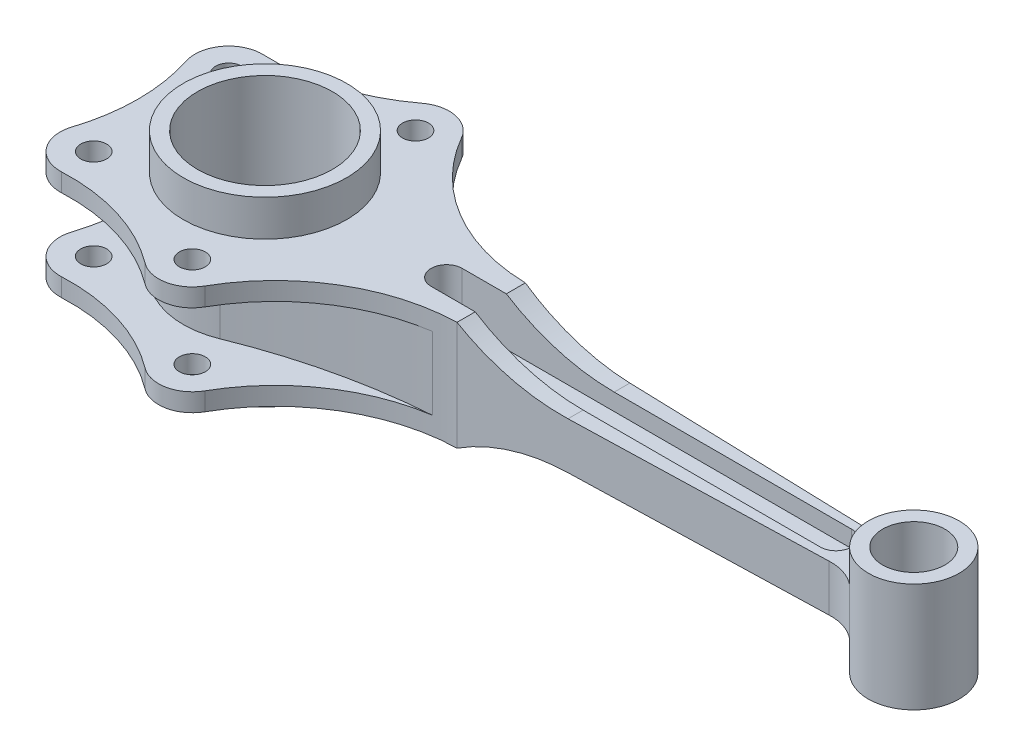
from build123d import *

# Parameters (mm, degrees)
SKETCH1_R               = 17.5
SKETCH1_R_2             = 12
BOSS_EXTRUDE1_DEPTH     = 21
BOSS_EXTRUDE2_DEPTH     = 2.5
BOSS_EXTRUDE3_DEPTH     = 21
SKETCH1_6_R             = 31.5
SKETCH1_6_R_2           = 26
BOSS_EXTRUDE4_DEPTH     = 35
BOSS_EXTRUDE5_START     = 14
SKETCH1_8_R             = 5
BOSS_EXTRUDE5_DEPTH     = 7
BOSS_EXTRUDE6_START     = -14
SKETCH1_9_R             = 5
BOSS_EXTRUDE6_DEPTH     = 7
BOSS_EXTRUDE7_DEPTH     = 21
CUT_EXTRUDE1_DEPTH      = 209.248049211
CUT_EXTRUDE1_DEPTH_BACK = 209.248049211
CUT_EXTRUDE2_START      = -56
CUT_EXTRUDE2_DEPTH      = 56
CUT_EXTRUDE3_DEPTH      = 209.248049211
CUT_EXTRUDE3_DEPTH_BACK = 209.248049211
CUT_EXTRUDE4_DEPTH      = 212.910476009
CUT_EXTRUDE4_DEPTH_BACK = 212.910476009
SKETCH4_W               = 12.113399832
SKETCH4_H               = 12
CUT_EXTRUDE5_DEPTH      = 212.910476009
CUT_EXTRUDE5_DEPTH_BACK = 212.910476009
SKETCH4_3_W             = 12.113399832
SKETCH4_3_H             = 12
SKETCH5_R               = 17.5
SKETCH5_R_2             = 12
BOSS_EXTRUDE8_DEPTH     = 42


with BuildPart() as part:
    # Sketch1 → Boss-Extrude1 (new, symmetric)
    with BuildSketch(Plane(origin=(0, 0, 0), x_dir=(1, 0, 0), z_dir=(0, 1, 0))):
        with Locations(Location((180, 0, 0), (0, 0, 90))):
            Circle(SKETCH1_R)
        with Locations(Location((180, 0, 0), (0, 0, 90))):
            Circle(SKETCH1_R_2, mode=Mode.SUBTRACT)
    extrude(amount=BOSS_EXTRUDE1_DEPTH, both=True)


with BuildPart() as body_2:
    # Sketch1<4> → Boss-Extrude2 (new, symmetric)
    with BuildSketch(Plane(origin=(0, 0, 0), x_dir=(1, 0, 0), z_dir=(0, 1, 0))):
        with BuildLine():
            Line((0, -6), (150, -6))
            ThreePointArc((150, -6), (156, 0), (150, 6))
            Line((150, 6), (0, 6))
            ThreePointArc((0, 6), (-6, 0), (0, -6))
        make_face()
    extrude(amount=BOSS_EXTRUDE2_DEPTH, both=True)


with BuildPart() as body_3:
    # Sketch1<5> → Boss-Extrude3 (new, symmetric)
    with BuildSketch(Plane(origin=(0, 0, 0), x_dir=(1, 0, 0), z_dir=(0, 1, 0))):
        with BuildLine():
            Line((156.058996925, 9.03318931), (17, 13.317393816))
            Line((17, 13.317393816), (17, 6))
            Line((17, 6), (150, 6))
            ThreePointArc((150, 6), (156, 0), (150, -6))
            Line((150, -6), (17, -6))
            Line((17, -6), (17, -13))
            Line((17, -13), (156.328879699, -9.01863519))
            ThreePointArc((156.328879699, -9.01863519), (156.636409525, -9.007140421), (156.944093932, -9.001055257))
            ThreePointArc((156.944093932, -9.001055257), (163.144268536, -10.063638089), (168.568136635, -13.25))
            ThreePointArc((168.568136635, -13.25), (162.5, 0), (168.568136635, 13.25))
            ThreePointArc((168.568136635, 13.25), (163.234428728, 10.096875298), (157.13627327, 9))
            ThreePointArc((157.13627327, 9), (156.597379529, 9.008299295), (156.058996925, 9.03318931))
        make_face()
    extrude(amount=BOSS_EXTRUDE3_DEPTH, both=True)


with BuildPart() as body_4:
    # Sketch1<6> → Boss-Extrude4 (new, symmetric)
    with BuildSketch(Plane(origin=(0, 0, 0), x_dir=(1, 0, 0), z_dir=(0, 1, 0))):
        with Locations(Location((-70, 0, 0), (0, 0, 270))):
            Circle(SKETCH1_6_R)
        with Locations(Location((-70, 0, 0), (0, 0, 270))):
            Circle(SKETCH1_6_R_2, mode=Mode.SUBTRACT)
    extrude(amount=BOSS_EXTRUDE4_DEPTH, both=True)

    # Sketch1<8> → Boss-Extrude5 (add)
    with BuildSketch(Plane(origin=(0, 0, 0), x_dir=(1, 0, 0), z_dir=(0, 1, 0)).offset(BOSS_EXTRUDE5_START)):
        with BuildLine():
            ThreePointArc((-58.156980956, 29.188917416), (-21.997231739, 18.064539792), (15.542269663, 13.367192084))
            ThreePointArc((15.542269663, 13.367192084), (-18.727205495, 23.806647622), (-43.723768891, 49.46889573))
            ThreePointArc((-43.723768891, 49.46889573), (-52.387237507, 55.734734868), (-62.818053323, 53.386435492))
            ThreePointArc((-62.818053323, 53.386435492), (-84.855989459, 42.122318837), (-109.406288617, 38.986435492))
            ThreePointArc((-109.406288617, 38.986435492), (-120.326951915, 33.896458963), (-122.376901133, 22.023529412))
            ThreePointArc((-122.376901133, 22.023529412), (-118.925892025, 0), (-122.376901133, -22.023529412))
            ThreePointArc((-122.376901133, -22.023529412), (-120.326951915, -33.896458963), (-109.406288617, -38.986435492))
            ThreePointArc((-109.406288617, -38.986435492), (-84.855989459, -42.122318837), (-62.818053323, -53.386435492))
            ThreePointArc((-62.818053323, -53.386435492), (-52.359466146, -55.729005498), (-43.695655766, -49.419641847))
            ThreePointArc((-43.695655766, -49.419641847), (-21.801490982, -25.591683128), (8.316675692, -13.758589512))
            ThreePointArc((8.316675692, -13.758589512), (-25.528416407, -18.853360845), (-58.156980956, -29.188917416))
            ThreePointArc((-58.156980956, -29.188917416), (-101.5, 0), (-58.156980956, 29.188917416))
        make_face()
        with Locations(Location((-55, -43, 0), (0, 0, 270))):
            Circle(SKETCH1_8_R, mode=Mode.SUBTRACT)
        with Locations(Location((-110, -26, 0), (0, 0, 270))):
            Circle(SKETCH1_8_R, mode=Mode.SUBTRACT)
        with Locations(Location((-110, 26, 0), (0, 0, 270))):
            Circle(SKETCH1_8_R, mode=Mode.SUBTRACT)
        with Locations(Location((-55, 43, 0), (0, 0, 270))):
            Circle(SKETCH1_8_R, mode=Mode.SUBTRACT)
    extrude(amount=BOSS_EXTRUDE5_DEPTH)

    # Sketch1<9> → Boss-Extrude6 (add)
    with BuildSketch(Plane(origin=(0, 0, 0), x_dir=(1, 0, 0), z_dir=(0, 1, 0)).offset(BOSS_EXTRUDE6_START)):
        with BuildLine():
            ThreePointArc((-58.156980956, 29.188917416), (-21.997231739, 18.064539792), (15.542269663, 13.367192084))
            ThreePointArc((15.542269663, 13.367192084), (-18.727205495, 23.806647622), (-43.723768891, 49.46889573))
            ThreePointArc((-43.723768891, 49.46889573), (-52.387237507, 55.734734868), (-62.818053323, 53.386435492))
            ThreePointArc((-62.818053323, 53.386435492), (-84.855989459, 42.122318837), (-109.406288617, 38.986435492))
            ThreePointArc((-109.406288617, 38.986435492), (-120.326951915, 33.896458963), (-122.376901133, 22.023529412))
            ThreePointArc((-122.376901133, 22.023529412), (-118.925892025, 0), (-122.376901133, -22.023529412))
            ThreePointArc((-122.376901133, -22.023529412), (-120.326951915, -33.896458963), (-109.406288617, -38.986435492))
            ThreePointArc((-109.406288617, -38.986435492), (-84.855989459, -42.122318837), (-62.818053323, -53.386435492))
            ThreePointArc((-62.818053323, -53.386435492), (-52.359466146, -55.729005498), (-43.695655766, -49.419641847))
            ThreePointArc((-43.695655766, -49.419641847), (-21.801490982, -25.591683128), (8.316675692, -13.758589512))
            ThreePointArc((8.316675692, -13.758589512), (-25.528416407, -18.853360845), (-58.156980956, -29.188917416))
            ThreePointArc((-58.156980956, -29.188917416), (-101.5, 0), (-58.156980956, 29.188917416))
        make_face()
        with Locations(Location((-55, -43, 0), (0, 0, 270))):
            Circle(SKETCH1_9_R, mode=Mode.SUBTRACT)
        with Locations(Location((-110, -26, 0), (0, 0, 270))):
            Circle(SKETCH1_9_R, mode=Mode.SUBTRACT)
        with Locations(Location((-110, 26, 0), (0, 0, 270))):
            Circle(SKETCH1_9_R, mode=Mode.SUBTRACT)
        with Locations(Location((-55, 43, 0), (0, 0, 270))):
            Circle(SKETCH1_9_R, mode=Mode.SUBTRACT)
    extrude(amount=-BOSS_EXTRUDE6_DEPTH)


with BuildPart() as boss_extrude7_tool:
    # Sketch1<10> → Boss-Extrude7 (new, symmetric)
    with BuildSketch(Plane(origin=(0, 0, 0), x_dir=(1, 0, 0), z_dir=(0, 1, 0))):
        with BuildLine():
            Line((17, 6), (17, 13.317393816))
            ThreePointArc((17, 13.317393816), (16.271008726, 13.338601506), (15.542269663, 13.367192084))
            ThreePointArc((15.542269663, 13.367192084), (-21.997231739, 18.064539792), (-58.156980956, 29.188917416))
            ThreePointArc((-58.156980956, 29.188917416), (-43.872379558, 17.595381498), (-38.5, 0))
            Line((-38.5, 0), (-6, 0))
            ThreePointArc((-6, 0), (-4.242640687, 4.242640687), (0, 6))
            Line((0, 6), (17, 6))
        make_face()
        with BuildLine():
            ThreePointArc((0, -6), (-4.242640687, -4.242640687), (-6, 0))
            Line((-6, 0), (-38.5, 0))
            ThreePointArc((-38.5, 0), (-43.872379558, -17.595381498), (-58.156980956, -29.188917416))
            ThreePointArc((-58.156980956, -29.188917416), (-25.528416407, -18.853360845), (8.316675692, -13.758589512))
            ThreePointArc((8.316675692, -13.758589512), (12.646847854, -13.247772605), (17, -13))
            Line((17, -13), (17, -6))
            Line((17, -6), (0, -6))
        make_face()
    extrude(amount=BOSS_EXTRUDE7_DEPTH, both=True)


with BuildPart() as body_3_1:
    add(body_3.part)


with BuildPart() as body_3_2:
    # Boss-Extrude7: joined with boss_extrude7_tool
    add(body_3_1.part.fuse(boss_extrude7_tool.part, body_4.part, tol=0.00001))

    # Sketch3 → Cut-Extrude1 (cut, two sides: drawn at the far end of the back side and taken through both)
    with BuildSketch(Plane.XY.offset(-CUT_EXTRUDE1_DEPTH_BACK)):
        with BuildLine():
            Line((156.328879699, 9), (58.569219382, 9))
            ThreePointArc((58.569219382, 9), (36.935911729, 12.060024019), (17, 21))
            Line((17, 21), (156.328879699, 21))
            Line((156.328879699, 21), (156.328879699, 9))
        make_face()
    extrude(amount=CUT_EXTRUDE1_DEPTH + CUT_EXTRUDE1_DEPTH_BACK, mode=Mode.SUBTRACT)

    # Cut-Extrude2: read off the stored shape, not the designer's step
    # Cut-Extrude2 outline → Cut-Extrude2 (cut)
    with BuildSketch(Plane.XY.offset(CUT_EXTRUDE2_START)):
        with BuildLine():
            Line((17, -21), (156.328879699, -21))
            Line((156.328879699, -21), (156.328879699, -9))
            Line((156.328879699, -9), (58.569219382, -9))
            ThreePointArc((58.569219382, -9), (36.935911729, -12.060024019), (17, -21))
        make_face()
    extrude(amount=CUT_EXTRUDE2_DEPTH, mode=Mode.SUBTRACT)

    # Sketch3<5> → Cut-Extrude3 (cut, two sides: drawn at the far end of the back side and taken through both)
    with BuildSketch(Plane.XY.offset(-CUT_EXTRUDE3_DEPTH_BACK)):
        with BuildLine():
            Line((156.328879699, -9), (58.569219382, -9))
            ThreePointArc((58.569219382, -9), (36.935911729, -12.060024019), (17, -21))
            Line((17, -21), (156.328879699, -21))
            Line((156.328879699, -21), (156.328879699, -9))
        make_face()
    extrude(amount=CUT_EXTRUDE3_DEPTH + CUT_EXTRUDE3_DEPTH_BACK, mode=Mode.SUBTRACT)


with BuildPart() as cut_extrude4_tool:
    # Sketch4 → Cut-Extrude4 (new, two sides: drawn at the far end of the back side and taken through both)
    with BuildSketch(Plane(origin=(0.385045831, 0, 13.474777333), x_dir=(0.9995919759201641, 0, -0.028563642555212748), z_dir=(0.028563642555212748, 0, 0.9995919759201641)).offset(-CUT_EXTRUDE4_DEPTH_BACK)):
        with Locations((162.064188596, 15)):
            Rectangle(SKETCH4_W, SKETCH4_H)
    extrude(amount=CUT_EXTRUDE4_DEPTH + CUT_EXTRUDE4_DEPTH_BACK)


with BuildPart() as part_1:
    add(part.part)

    # Cut-Extrude4: cut by cut_extrude4_tool
    add(cut_extrude4_tool.part, mode=Mode.SUBTRACT)


with BuildPart() as body_3_3:
    add(body_3_2.part)

    # Cut-Extrude4: cut by cut_extrude4_tool
    add(cut_extrude4_tool.part, mode=Mode.SUBTRACT)


with BuildPart() as cut_extrude5_tool:
    # Sketch4<3> → Cut-Extrude5 (new, two sides: drawn at the far end of the back side and taken through both)
    with BuildSketch(Plane(origin=(0.385045831, 0, 13.474777333), x_dir=(0.9995919759201641, 0, -0.028563642555212748), z_dir=(0.028563642555212748, 0, 0.9995919759201641)).offset(-CUT_EXTRUDE5_DEPTH_BACK)):
        with Locations((162.064188596, 15)):
            Rectangle(SKETCH4_3_W, SKETCH4_3_H)
        with Locations((162.064188596, -15)):
            Rectangle(SKETCH4_3_W, SKETCH4_3_H)
    extrude(amount=CUT_EXTRUDE5_DEPTH + CUT_EXTRUDE5_DEPTH_BACK)


with BuildPart() as part_2:
    add(part_1.part)

    # Cut-Extrude5: cut by cut_extrude5_tool
    add(cut_extrude5_tool.part, mode=Mode.SUBTRACT)



with BuildPart() as body_3_4:
    add(body_3_3.part)

    # Cut-Extrude5: cut by cut_extrude5_tool
    add(cut_extrude5_tool.part, mode=Mode.SUBTRACT)


with BuildPart() as part_3:
    add(part_2.part)

    add(body_3_4.part)  # Boss-Extrude8 merges body 3
    # Sketch5 → Boss-Extrude8 (add)
    with BuildSketch(Plane(origin=(0, 21, 0), x_dir=(1, 0, 0), z_dir=(0, 1, 0))):
        with Locations((180, 0)):
            Circle(SKETCH5_R)
        with Locations(Location((180, 0, 0), (0, 0, 270))):
            Circle(SKETCH5_R_2, mode=Mode.SUBTRACT)
    extrude(amount=-BOSS_EXTRUDE8_DEPTH)


solid = Compound([body_2.part, part_3.part])
